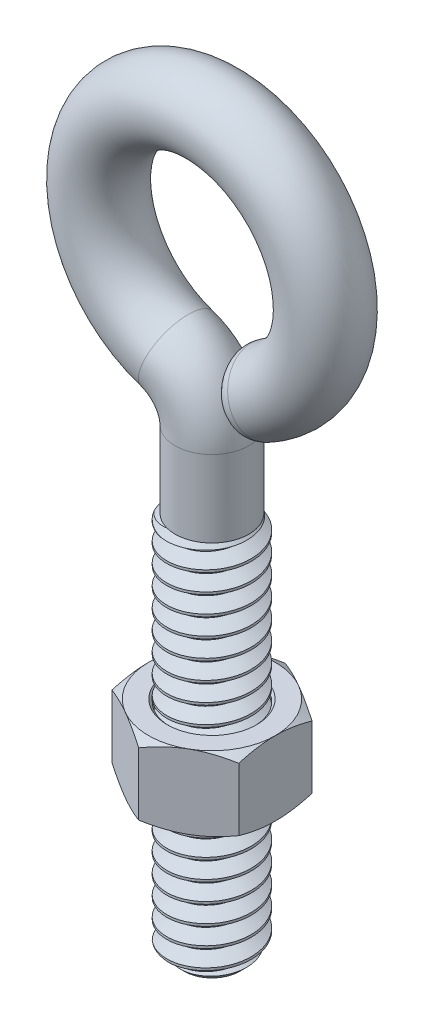
from build123d import *

# Parameters (mm, degrees)
BOSS_EXTRUDE1_START = -9.652
SKETCH2_R           = 1.7526
BOSS_EXTRUDE1_DEPTH = 15.875
CUT_SWEEP1_PITCH    = 0.79375
SKETCH5_OUTSIDE_W   = 40.582
SKETCH5_OUTSIDE_H   = 40.582
SKETCH5_OUTSIDE_R   = 1.151118294
CUT_EXTRUDE1_DEPTH  = 15.875
CUT_EXTRUDE1_DRAFT  = -45
SKETCH6_OUTSIDE_W   = 40.582
SKETCH6_OUTSIDE_H   = 40.582
SKETCH6_OUTSIDE_R   = 1.524
CUT_EXTRUDE2_DEPTH  = 15.875
CUT_EXTRUDE2_DRAFT  = -45
SKETCH7_R           = 1.524
FILLET1_R           = 0.8763
BOSS_EXTRUDE2_START = -6.1341
SKETCH9_R           = 1.7526
BOSS_EXTRUDE2_DEPTH = 3.06705


with BuildPart() as part:
    # Sketch2 → Boss-Extrude1 (new body)
    with BuildSketch(Plane(origin=(0, 0, 0), x_dir=(1, 0, 0), z_dir=(0, 1, 0)).offset(BOSS_EXTRUDE1_START)):
        with Locations(Location((0, 0, 0), (0, 0, 270))):
            Circle(SKETCH2_R)
    extrude(amount=-BOSS_EXTRUDE1_DEPTH)

    # Cut-Sweep1: the profile of Sketch4 screwed along a right-hand helix of 21 turns, 8 arcs to a turn; built about Z, then put on its axis
    cut_sweep1_z = Axis((0, 0, 0), (0, 0, 1))
    cut_sweep1_corners = [(1.795562979, 0, 0.024804687), (1.237044252, 0, -0.29765625), (1.237044252, 0, -0.396875), (1.795562979, 0, -0.719335938)]
    with BuildLine(mode=Mode.PRIVATE) as cut_sweep1_profile:
        Line(cut_sweep1_corners[0], cut_sweep1_corners[1])
        Line(cut_sweep1_corners[1], cut_sweep1_corners[2])
        Line(cut_sweep1_corners[2], cut_sweep1_corners[3])
        Line(cut_sweep1_corners[3], cut_sweep1_corners[0])
    cut_sweep1_cap = Face(cut_sweep1_profile.wire())
    cut_sweep1_turn_angles = [0, 22.5, 45, 67.5, 90, 112.5, 135, 157.5, 180, 202.5, 225, 247.5, 270, 292.5, 315, 337.5, 360]
    cut_sweep1_turn_weights = [1, 0.9238795325112867, 1, 0.9238795325112867, 1, 0.9238795325112867, 1, 0.9238795325112867, 1, 0.9238795325112867, 1, 0.9238795325112867, 1, 0.9238795325112867, 1, 0.9238795325112867, 1]
    cut_sweep1_turn_rails = [Edge.make_bspline([Vector(p[0], p[1], 0).rotate(cut_sweep1_z, cut_sweep1_turn_angles[k]) / cut_sweep1_turn_weights[k] + Vector(0, 0, p[2] + CUT_SWEEP1_PITCH * cut_sweep1_turn_angles[k] / 360) for k in range(17)], [0, 0, 0, 1, 1, 2, 2, 3, 3, 4, 4, 5, 5, 6, 6, 7, 7, 8, 8, 8], 2, cut_sweep1_turn_weights) for p in cut_sweep1_corners]
    cut_sweep1_turn_sides = [Face.make_surface_from_curves(cut_sweep1_turn_rails[p[0]], cut_sweep1_turn_rails[p[1]]) for p in [(0, 1), (1, 2), (2, 3), (3, 0)]]
    cut_sweep1 = Plane(origin=(0, -25.527, 0), x_dir=(1, 0, 0), z_dir=(0, 1, 0)) * Solid(Shell([*[p.moved(Location((0, 0, CUT_SWEEP1_PITCH * i))) for i in range(21) for p in cut_sweep1_turn_sides], cut_sweep1_cap, cut_sweep1_cap.rotate(cut_sweep1_z, 7560).moved(Location((0, 0, CUT_SWEEP1_PITCH * 7560 / 360)))]))
    add(cut_sweep1, mode=Mode.SUBTRACT)


with BuildPart() as cut_extrude1_tool:
    # Sketch5 outside → Cut-Extrude1 (with draft: the straight prism first)
    with BuildSketch(Plane.XZ.offset(25.527)):
        Rectangle(SKETCH5_OUTSIDE_W, SKETCH5_OUTSIDE_H)
        Circle(SKETCH5_OUTSIDE_R, mode=Mode.SUBTRACT)
    extrude(amount=-CUT_EXTRUDE1_DEPTH)
    # Cut-Extrude1: the draft: its side faces are tilted about the plane it starts from
    cut_extrude1_sides = [cut_extrude1_tool.faces().sort_by_distance(p)[0] for p in [
        (0, -17.5895, -20.291),
        (20.291, -17.5895, 0),
        (0, -17.5895, 20.291),
        (-20.291, -17.5895, 0),
        (-1.151118294, -17.5895, 0),
    ]]
    draft(cut_extrude1_sides, Plane.XZ.offset(25.527), CUT_EXTRUDE1_DRAFT)


with BuildPart() as part_1:
    add(part.part)

    # Cut-Extrude1: cut by cut_extrude1_tool
    add(cut_extrude1_tool.part, mode=Mode.SUBTRACT)


with BuildPart() as cut_extrude2_tool:
    # Sketch6 outside → Cut-Extrude2 (with draft: the straight prism first)
    with BuildSketch(Plane(origin=(0, -9.652, 0), x_dir=(1, 0, 0), z_dir=(0, 1, 0))):
        Rectangle(SKETCH6_OUTSIDE_W, SKETCH6_OUTSIDE_H)
        Circle(SKETCH6_OUTSIDE_R, mode=Mode.SUBTRACT)
    extrude(amount=-CUT_EXTRUDE2_DEPTH)
    # Cut-Extrude2: the draft: its side faces are tilted about the plane it starts from
    cut_extrude2_sides = [cut_extrude2_tool.faces().sort_by_distance(p)[0] for p in [
        (0, -17.5895, 20.291),
        (20.291, -17.5895, 0),
        (0, -17.5895, -20.291),
        (-20.291, -17.5895, 0),
        (-1.524, -17.5895, 0),
    ]]
    draft(cut_extrude2_sides, Plane(origin=(0, -9.652, 0), x_dir=(1, 0, 0), z_dir=(0, 1, 0)), CUT_EXTRUDE2_DRAFT)


with BuildPart() as part_2:
    add(part_1.part)

    # Cut-Extrude2: cut by cut_extrude2_tool
    add(cut_extrude2_tool.part, mode=Mode.SUBTRACT)

    # Sweep1: sweep along a path in Sketch8
    with BuildLine(Plane.XY) as sweep1_path:
        Line((0, -9.652), (0, -6.477))
        ThreePointArc((0, -6.477), (-0.402954324, -5.235378627), (-1.458228715, -4.467009068))
        ThreePointArc((-1.458228715, -4.467009068), (-0.024024411, 4.698938585), (1.503828522, -4.451864865))
    # Sketch7 → Sweep1 (sweep)
    with BuildSketch(Plane(origin=(0, -9.652, 0), x_dir=(1, 0, 0), z_dir=(0, 1, 0))):
        Circle(SKETCH7_R)
    sweep(path=sweep1_path.line)

    # Fillet1
    fillet1_edges = [part_2.edges().sort_by_distance(p)[0] for p in [
        (1.991556692, -5.895712929, 0),
    ]]
    fillet(fillet1_edges, radius=FILLET1_R)


with BuildPart() as body_2:
    # Sketch9 → Boss-Extrude2 (new body)
    with BuildSketch(Plane.XZ.offset(25.527).offset(BOSS_EXTRUDE2_START)):
        Polygon((0, 3.035592245), (-2.6289, 1.517796123), (-2.6289, -1.517796123), (0, -3.035592245), (2.6289, -1.517796123), (2.6289, 1.517796123), align=None)
        with Locations(Location((0, 0, 0), (0, 0, 270))):
            Circle(SKETCH9_R, mode=Mode.SUBTRACT)
    extrude(amount=-BOSS_EXTRUDE2_DEPTH)

    # Sketch10 → Cut-Revolve1 (revolve, cut)
    with BuildSketch(Plane(origin=(0, 0, 0), x_dir=(0, 0, -1), z_dir=(1, 0, 0)), mode=Mode.PRIVATE) as cut_revolve1_sk:
        Polygon((-2.6289, -16.32585), (-3.442284491, -16.32585), (-3.442284491, -19.3929), (-2.6289, -19.3929), (-3.035592245, -19.158096123), (-3.035592245, -16.560653877), align=None)
        Polygon((-1.65338125, -16.32585), (-1.65338125, -19.3929), (-1.85181875, -19.3929), (-1.7526, -19.29368125), (-1.7526, -16.42506875), (-1.85181875, -16.32585), align=None)
    revolve(cut_revolve1_sk.sketch.rotate(Axis((0, -6.477, 0), (0, -1, 0)), 90), axis=Axis((0, -6.477, 0), (0, -1, 0)), mode=Mode.SUBTRACT)


solid = Compound([part_2.part, body_2.part])
